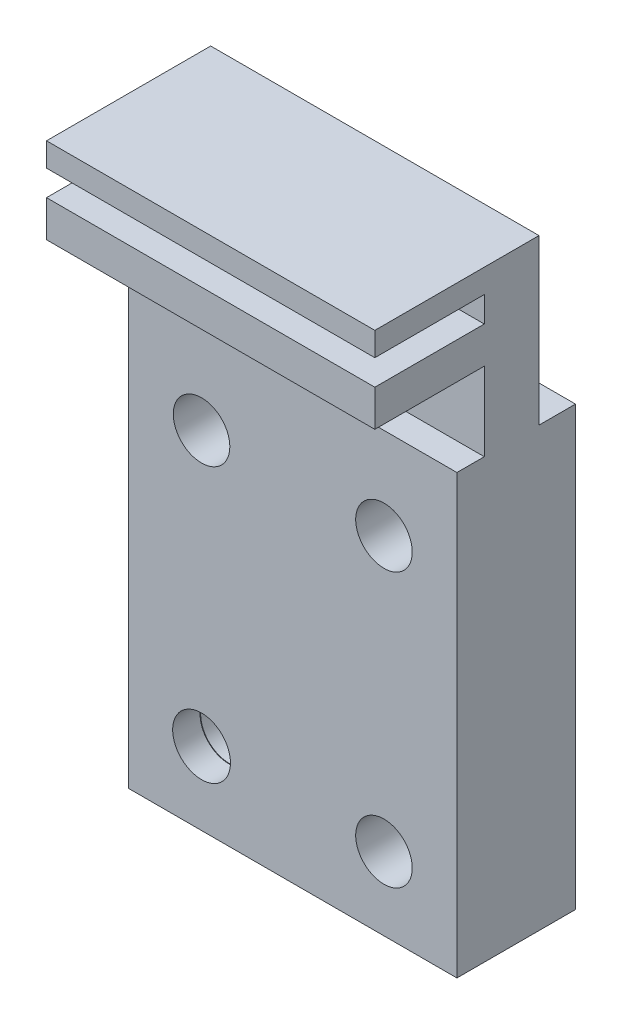
from build123d import *

# Parameters (mm, degrees)
SKIZZE1_W                       = 18
SKIZZE1_H                       = 33
SKIZZE1_R                       = 1.55
AUFSATZ_LINEAR_AUSTRAGEN3_DEPTH = 5
SKIZZE1_4_W                     = 18
SKIZZE1_4_H                     = 2
SKIZZE1_4_H_2                   = 1.3
AUFSATZ_LINEAR_AUSTRAGEN4_DEPTH = 6
SKIZZE2_W                       = 2
SKIZZE2_H                       = 9
SCHNITT_LINEAR_AUSTRAGEN1_DEPTH = 29.674901918
AUFSATZ_LINEAR_START            = 1.5
SKIZZE3_W                       = 18
SKIZZE3_H                       = 24
SKIZZE3_R                       = 1.55
SKIZZE3_R_2                     = 1.583705608
AUFSATZ_LINEAR_AUSTRAGEN5_DEPTH = 1.5


with BuildPart() as part:
    # Skizze1 → Aufsatz-Linear austragen3 (new body)
    with BuildSketch(Plane.XY):
        with Locations((0, 5)):
            Rectangle(SKIZZE1_W, SKIZZE1_H)
        with Locations((5, 7.5)):
            Circle(SKIZZE1_R, mode=Mode.SUBTRACT)
        with Locations((-5, -7.5)):
            Circle(SKIZZE1_R, mode=Mode.SUBTRACT)
        with Locations((5, -7.5)):
            Circle(SKIZZE1_R, mode=Mode.SUBTRACT)
        with Locations((-5, 7.5)):
            Circle(SKIZZE1_R, mode=Mode.SUBTRACT)
    extrude(amount=-AUFSATZ_LINEAR_AUSTRAGEN3_DEPTH)

    # Skizze1<4> → Aufsatz-Linear austragen4 (add)
    with BuildSketch(Plane.XY):
        with Locations((0, 17.8)):
            Rectangle(SKIZZE1_4_W, SKIZZE1_4_H)
        with Locations((0, 20.85)):
            Rectangle(SKIZZE1_4_W, SKIZZE1_4_H_2)
    extrude(amount=AUFSATZ_LINEAR_AUSTRAGEN4_DEPTH)

    # Skizze2 → Schnitt-Linear austragen1 (cut, through all)
    with BuildSketch(Plane(origin=(9, 0, 0), x_dir=(0, 0, -1), z_dir=(1, 0, 0))):
        with Locations((4, 17)):
            Rectangle(SKIZZE2_W, SKIZZE2_H)
    extrude(amount=-SCHNITT_LINEAR_AUSTRAGEN1_DEPTH, mode=Mode.SUBTRACT)

    # Skizze3 → Aufsatz-Linear austragen5 (add)
    with BuildSketch(Plane.XY.offset(AUFSATZ_LINEAR_START)):
        with Locations((0, 0.5)):
            Rectangle(SKIZZE3_W, SKIZZE3_H)
        with Locations((-5, 7.5)):
            Circle(SKIZZE3_R, mode=Mode.SUBTRACT)
        with Locations((5, 7.5)):
            Circle(SKIZZE3_R, mode=Mode.SUBTRACT)
        with Locations((-5, -7.5)):
            Circle(SKIZZE3_R_2, mode=Mode.SUBTRACT)
        with Locations((5, -7.5)):
            Circle(SKIZZE3_R, mode=Mode.SUBTRACT)
    extrude(amount=-AUFSATZ_LINEAR_AUSTRAGEN5_DEPTH)


solid = part.part
